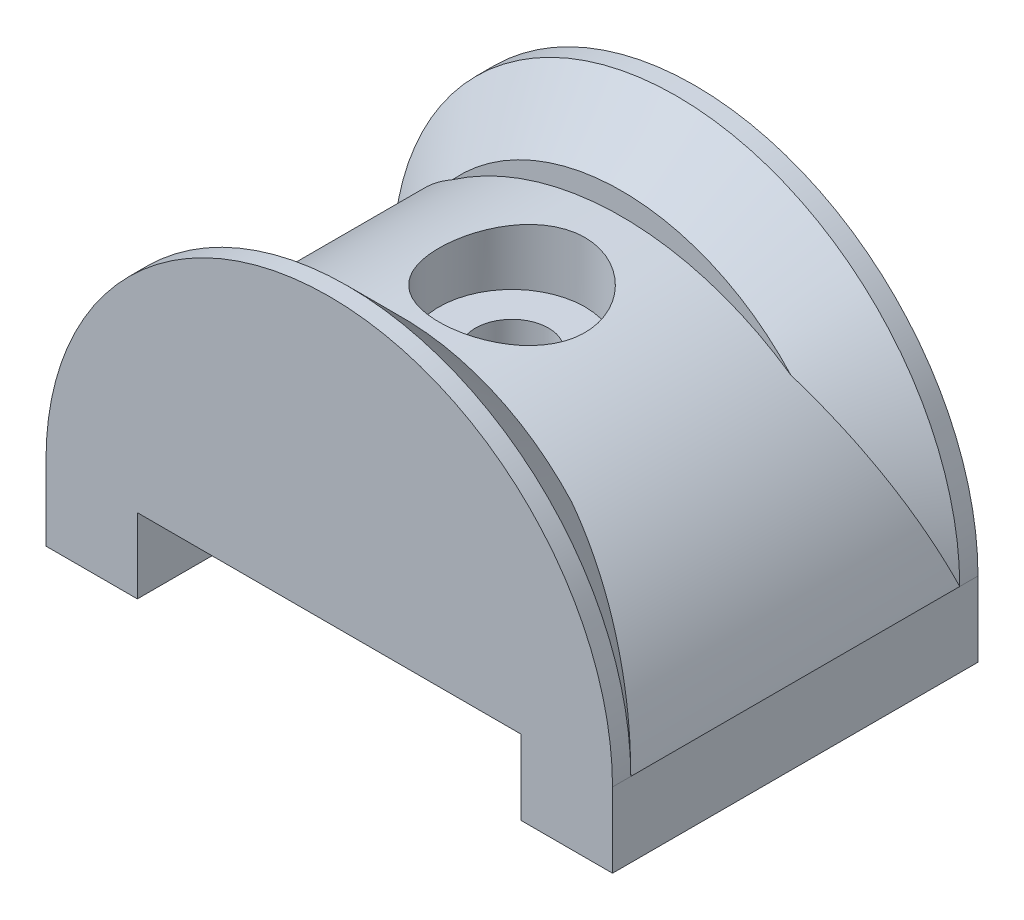
from build123d import *

# Parameters (mm, degrees)
ESQUISSE1_W             = 5
ESQUISSE1_H             = 4.088235294
BOSS_EXTRU_1_DEPTH      = 20
ENL_V_START             = -16
ENL_V_MAT_EXTRU_1_DEPTH = 12
CHANFREIN1_SIZE         = 3
ESQUISSE3_R             = 2
ENL_V_MAT_EXTRU_2_DEPTH = 12
ENL_V_START_2           = -8
ESQUISSE4_R             = 4
ENL_V_MAT_EXTRU_3_DEPTH = 12


with BuildPart() as part:
    # Esquisse1 → Boss.-Extru.1 (new body)
    with BuildSketch(Plane.XY):
        with BuildLine():
            ThreePointArc((-14.409025375, 0), (1.090974625, 15.5), (16.590974625, 0))
            Line((16.590974625, 0), (11.590974625, 0))
            Line((11.590974625, 0), (-9.409025375, 0))
            Line((-9.409025375, 0), (-14.409025375, 0))
        make_face()
        with Locations((-11.909025375, -2.044117647)):
            Rectangle(ESQUISSE1_W, ESQUISSE1_H)
        with Locations((14.090974625, -2.044117647)):
            Rectangle(ESQUISSE1_W, ESQUISSE1_H)
    extrude(amount=BOSS_EXTRU_1_DEPTH)

    # Esquisse2 → Enlèv. mat.-Extru.1 (cut)
    with BuildSketch(Plane.XY.offset(20).offset(ENL_V_START)):
        with BuildLine():
            ThreePointArc((-14.409025375, 0), (1.090974625, 11.286497475), (16.590974625, 0))
            ThreePointArc((16.590974625, 0), (1.090974625, 15.5), (-14.409025375, 0))
        make_face()
    extrude(amount=ENL_V_MAT_EXTRU_1_DEPTH, mode=Mode.SUBTRACT)

    # Chanfrein1
    # the kernel refuses this chamfer: 3 mm, written as the material it takes off along each edge
    with BuildSketch(Plane(origin=(1.090974625, 0, 4), x_dir=(0.8782789278300123, -0.4781486431328276, 0), z_dir=(-0.4781486431328276, -0.8782789278300123, 0))) as chanfrein1_piece_1_section:
        Polygon((15.5, -CHANFREIN1_SIZE), (15.5 - CHANFREIN1_SIZE, 0), (15.5, 0), align=None)
    chanfrein1_piece_1 = revolve(axis=Axis((1.090974625, 0, 4), (0, 0, 1)), revolution_arc=237.129113272, mode=Mode.PRIVATE)
    chanfrein1_piece_1 = chanfrein1_piece_1 - Plane(origin=(1.090974625, -5, 2.541086631), x_dir=(-0.9517086177605509, 0.3070027799227584, 0), z_dir=(0, 0, -1)) * Cylinder(16.286497475, 63, mode=Mode.PRIVATE)
    add(chanfrein1_piece_1, mode=Mode.SUBTRACT)
    with BuildSketch(Plane(origin=(1.090974625, 0, 16), x_dir=(0.8782789278300122, -0.4781486431328277, 0), z_dir=(-0.4781486431328277, -0.8782789278300122, 0))) as chanfrein1_piece_2_section:
        Polygon((15.5, CHANFREIN1_SIZE), (15.5 - CHANFREIN1_SIZE, 0), (15.5, 0), align=None)
    chanfrein1_piece_2 = revolve(axis=Axis((1.090974625, 0, 16), (0, 0, 1)), revolution_arc=237.129113272, mode=Mode.PRIVATE)
    chanfrein1_piece_2 = chanfrein1_piece_2 - Plane(origin=(1.090974625, -5, 17.458913369), x_dir=(-0.9517086177605509, 0.3070027799227584, 0), z_dir=(0, 0, -1)) * Cylinder(16.286497475, 62, mode=Mode.PRIVATE)
    add(chanfrein1_piece_2, mode=Mode.SUBTRACT)

    # Esquisse3 → Enlèv. mat.-Extru.2 (cut)
    with BuildSketch(Plane.XZ):
        with Locations(Location((1.090974625, 10, 0), (0, 0, 270))):
            Circle(ESQUISSE3_R)
    extrude(amount=-ENL_V_MAT_EXTRU_2_DEPTH, mode=Mode.SUBTRACT)

    # Esquisse4 → Enlèv. mat.-Extru.3 (cut)
    with BuildSketch(Plane.XZ.offset(ENL_V_START_2)):
        with Locations(Location((1.090974625, 10, 0), (0, 0, 270))):
            Circle(ESQUISSE4_R)
    extrude(amount=-ENL_V_MAT_EXTRU_3_DEPTH, mode=Mode.SUBTRACT)


solid = part.part
